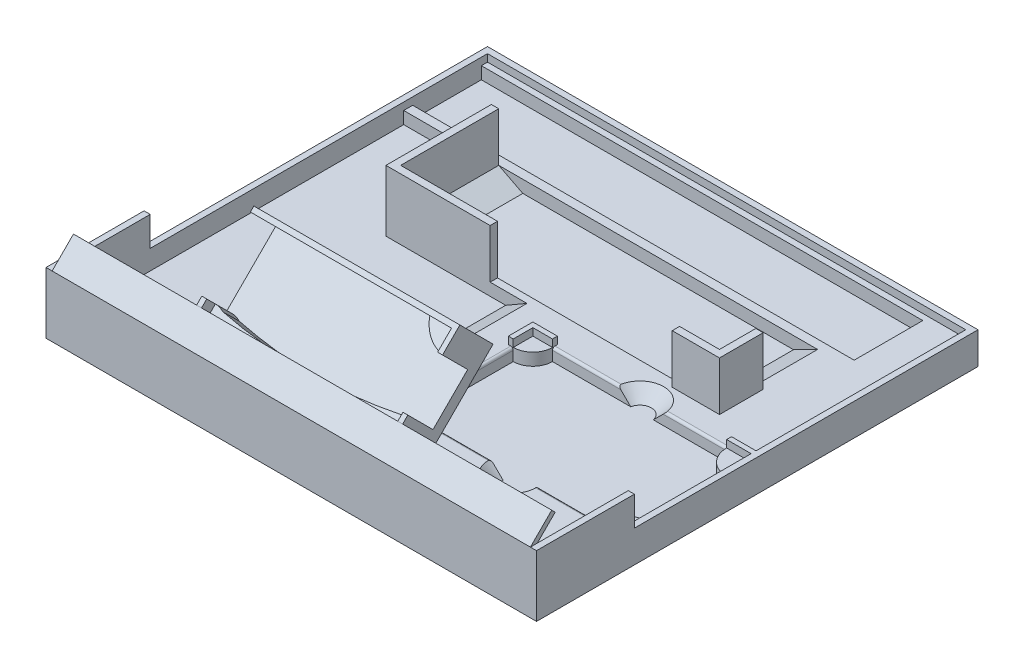
from build123d import *

# Parameters (mm, degrees)
SKETCH1_W            = 200
SKETCH1_H            = 180
BOSS_EXTRUDE1_DEPTH  = 10
SKETCH2_W            = 200
SKETCH2_H            = 180
SKETCH2_W_2          = 195
SKETCH2_H_2          = 175
BOSS_EXTRUDE2_DEPTH  = 3
SKETCH11_W           = 180
SKETCH11_H           = 28
CUT_EXTRUDE4_DEPTH   = 8
BOSS_EXTRUDE6_DEPTH  = 20
SKETCH4_W            = 10
SKETCH4_H            = 2
BOSS_EXTRUDE3_DEPTH  = 3
CUT_EXTRUDE1_DEPTH   = 5
CHAMFER1_SIZE        = 5
FILLET1_R            = 1
SKETCH7_W            = 84
SKETCH7_H            = 10
BOSS_EXTRUDE4_DEPTH  = 15
CHAMFER2_SIZE        = 10
SKETCH8_W            = 84
SKETCH8_H            = 14.142135624
BOSS_EXTRUDE5_DEPTH  = 40
BOSS_EXTRUDE12_DEPTH = 5
CUT_EXTRUDE5_DEPTH   = 9.5
LOFT2_START          = -40.961892057
LOFT2_DEPTH          = 3
LOFT3_START          = 61.722133944
LOFT3_OUTLINE_W      = 3
LOFT3_OUTLINE_H      = 43.678858874
LOFT3_DEPTH          = 4.277866056
LOFT5_START          = -40.961892057
LOFT5_DEPTH          = 3
LOFT6_START          = -21.123339187
LOFT6_DEPTH          = 3
SKETCH32_W           = 110
SKETCH32_H           = 35
CUT_EXTRUDE6_DEPTH   = 5
CHAMFER6_START       = -10.346513917
CHAMFER6_DEPTH       = 82.846513917
CHAMFER6_2_OUTLINE_W = 1.135860263
CHAMFER6_2_OUTLINE_H = 5
CHAMFER6_2_DEPTH     = 55.207581741
CHAMFER6_START_2     = 82.5
CHAMFER6_3_DEPTH     = 5
CHAMFER8_SIZE        = 5
BOSS_EXTRUDE13_DEPTH = 12
CHAMFER5_SIZE        = 2.5
SKETCH25_W           = 195
SKETCH25_H           = 2
BOSS_EXTRUDE14_DEPTH = 12.3
BOSS_EXTRUDE15_DEPTH = 10


with BuildPart() as part:
    # Sketch1 → Boss-Extrude1 (new body)
    with BuildSketch(Plane(origin=(0, 0, 0), x_dir=(1, 0, 0), z_dir=(0, 1, 0))):
        Rectangle(SKETCH1_W, SKETCH1_H)
    extrude(amount=BOSS_EXTRUDE1_DEPTH)

    # Sketch2 → Boss-Extrude2 (add)
    with BuildSketch(Plane(origin=(0, 10, 0), x_dir=(1, 0, 0), z_dir=(0, 1, 0))):
        Rectangle(SKETCH2_W, SKETCH2_H)
        Rectangle(SKETCH2_W_2, SKETCH2_H_2, mode=Mode.SUBTRACT)
    extrude(amount=BOSS_EXTRUDE2_DEPTH)

    # Sketch11 → Cut-Extrude4 (cut)
    with BuildSketch(Plane(origin=(0, 13, 0), x_dir=(1, 0, 0), z_dir=(0, 1, 0))):
        with Locations((-7.5, 71)):
            Rectangle(SKETCH11_W, SKETCH11_H)
    extrude(amount=-CUT_EXTRUDE4_DEPTH, mode=Mode.SUBTRACT)

    # Sketch12 → Boss-Extrude6 (add)
    with BuildSketch(Plane(origin=(0, 10, 0), x_dir=(1, 0, 0), z_dir=(0, 1, 0))):
        Polygon((-58.75108786, 53.346513917), (-58.75108786, 13.346513917), (-19.25919945, 13.346513917), (-19.25919945, 10.346513917), (-61.75108786, 10.346513917), (-61.75108786, 53.346513917), align=None)
        Polygon((71.24891214, 28.173917959), (71.24891214, 13.346513917), (54.976322897, 13.346513917), (54.976322897, 10.346513917), (74.24891214, 10.346513917), (74.24891214, 28.173917959), align=None)
    extrude(amount=BOSS_EXTRUDE6_DEPTH)

    # Sketch4 → Boss-Extrude3 (add)
    with BuildSketch(Plane(origin=(0, 10, 0), x_dir=(1, 0, 0), z_dir=(0, 1, 0))):
        Polygon((8.5, 0), (8.5, -8), (6.5, -8), (6.5, 2), (16.5, 2), (16.5, 0), align=None)
        Polygon((16.5, -52), (16.5, -54), (6.5, -54), (6.5, -44), (8.5, -44), (8.5, -52), align=None)
        with Locations((92.5, 1)):
            Rectangle(SKETCH4_W, SKETCH4_H)
        with Locations((92.5, -53)):
            Rectangle(SKETCH4_W, SKETCH4_H)
    extrude(amount=BOSS_EXTRUDE3_DEPTH)

    # Sketch5 → Cut-Extrude1 (cut)
    with BuildSketch(Plane(origin=(0, 10, 0), x_dir=(1, 0, 0), z_dir=(0, 1, 0))):
        with BuildLine():
            Line((16.5, 0), (48.405541733, 0))
            ThreePointArc((48.405541733, 0), (53, 3.841715626), (57.594458267, 0))
            Line((57.594458267, 0), (87.5, 0))
            ThreePointArc((87.5, 0), (90.428932188, -7.071067812), (97.5, -10))
            Line((97.5, -10), (97.5, -42))
            ThreePointArc((97.5, -42), (90.428932188, -44.928932188), (87.5, -52))
            Line((87.5, -52), (57.594458267, -52))
            ThreePointArc((57.594458267, -52), (53, -57.494692689), (48.405541733, -52))
            Line((48.405541733, -52), (16.5, -52))
            ThreePointArc((16.5, -52), (14.156854249, -46.343145751), (8.5, -44))
            Line((8.5, -44), (8.5, -8))
            ThreePointArc((8.5, -8), (14.156854249, -5.656854249), (16.5, 0))
        make_face()
    extrude(amount=-CUT_EXTRUDE1_DEPTH, mode=Mode.SUBTRACT)

    # Chamfer1
    chamfer1_edges = [part.edges().sort_by_distance(p)[0] for p in [
        (53, 10, -3.841715626),
        (53, 10, 57.494692689),
    ]]
    chamfer(chamfer1_edges, length=CHAMFER1_SIZE - 0.0001)  # a hair under: the kernel refuses the full size

    # Fillet1
    # the kernel refuses this fillet: 1 mm, written as the material it takes off along each edge
    with BuildSketch(Plane(origin=(8.5, 10, 44), x_dir=(-1, 0, 0), z_dir=(0, 0, -1))) as fillet1_piece_1:
        with BuildLine():
            CenterArc((FILLET1_R, -FILLET1_R), FILLET1_R, 90, 90)
            Line((0, -FILLET1_R), (0, 0))
            Line((0, 0), (FILLET1_R, 0))
        make_face()
    extrude(amount=36, mode=Mode.SUBTRACT)
    with BuildSketch(Plane(origin=(45.867287261, 10, 52), x_dir=(0, 0, 1), z_dir=(-1, 0, 0)), Plane(origin=(16.5, 10, 0), x_dir=(0, 0, -1), z_dir=(1, 0, 0))) as fillet1_piece_2:
        with BuildLine():
            CenterArc((FILLET1_R, -FILLET1_R), FILLET1_R, 90, 90)
            Line((0, -FILLET1_R), (0, 0))
            Line((0, 0), (FILLET1_R, 0))
        make_face()
    extrude(amount=29.367287261, mode=Mode.SUBTRACT)
    with BuildSketch(Plane(origin=(87.5, 10, 52), x_dir=(0, 0, 1), z_dir=(-1, 0, 0)), Plane(origin=(60.132712739, 10, 0), x_dir=(0, 0, -1), z_dir=(1, 0, 0))) as fillet1_piece_3:
        with BuildLine():
            CenterArc((FILLET1_R, -FILLET1_R), FILLET1_R, 90, 90)
            Line((0, -FILLET1_R), (0, 0))
            Line((0, 0), (FILLET1_R, 0))
        make_face()
    extrude(amount=27.367287261, mode=Mode.SUBTRACT)

    # Sketch7 → Boss-Extrude4 (add)
    with BuildSketch(Plane(origin=(0, 10, 0), x_dir=(1, 0, 0), z_dir=(0, 1, 0))):
        with Locations((-5.5, -77.5)):
            Rectangle(SKETCH7_W, SKETCH7_H)
    extrude(amount=BOSS_EXTRUDE4_DEPTH)

    # Chamfer2
    chamfer2_edges = [part.edges().sort_by_distance(p)[0] for p in [
        (-5.5, 25, 72.5),
    ]]
    chamfer(chamfer2_edges, length=CHAMFER2_SIZE - 0.0001)  # a hair under: the kernel refuses the full size

    # Sketch8 → Boss-Extrude5 (add)
    with BuildSketch(Plane(origin=(0, -28.75, 28.75), x_dir=(1, 0, 0), z_dir=(0, 0.7071067811865446, -0.7071067811865506))):
        with Locations((-5.5, -68.942911166)):
            Rectangle(SKETCH8_W, SKETCH8_H)
    extrude(amount=BOSS_EXTRUDE5_DEPTH)

    # Sketch22 → Boss-Extrude12 (add)
    with BuildSketch(Plane(origin=(0, 53.75, 53.75), x_dir=(1, 0, 0), z_dir=(0, 0.7071067811865507, 0.7071067811865446))):
        Polygon((-47.5, -0.658639918), (-47.5, -2.658639918), (-45.5, -2.658639918), (34.5, -2.658639918), (34.5, -10.658639918), (36.5, -10.658639918), (36.5, -0.658639918), align=None)
        Polygon((-47.5, -40.658639918), (36.5, -40.658639918), (36.5, -30.658639918), (34.5, -30.658639918), (34.5, -38.658639918), (-45.5, -38.658639918), (-45.5, -30.658639918), (-47.5, -30.658639918), align=None)
    extrude(amount=BOSS_EXTRUDE12_DEPTH)

    # Sketch23 → Cut-Extrude5 (cut)
    with BuildSketch(Plane(origin=(0, 53.75, 53.75), x_dir=(1, 0, 0), z_dir=(0, 0.7071067811865507, 0.7071067811865446))):
        with BuildLine():
            Line((-47.5, -2.658639918), (14.408313461, -2.658639918))
            Line((14.408313461, -2.658639918), (22.14057939, -2.658639918))
            ThreePointArc((22.14057939, -2.658639918), (27.138694447, -8.484119002), (34.5, -10.658639918))
            Line((34.5, -10.658639918), (36.5, -10.658639918))
            Line((36.5, -10.658639918), (36.5, -30.658639918))
            Line((36.5, -30.658639918), (34.5, -30.658639918))
            ThreePointArc((34.5, -30.658639918), (32.65013037, -30.875454044), (30.900530206, -31.514144331))
            ThreePointArc((30.900530206, -31.514144331), (-5.498259382, -34.440048812), (-41.897184507, -31.515830911))
            ThreePointArc((-41.897184507, -31.515830911), (-43.648307809, -30.875887447), (-45.5, -30.658639918))
            Line((-45.5, -30.658639918), (-47.5, -30.658639918))
            Line((-47.5, -30.658639918), (-47.5, -2.658639918))
        make_face()
    extrude(amount=-CUT_EXTRUDE5_DEPTH, mode=Mode.SUBTRACT)

    # Loft2: read off the stored shape, not the designer's step
    # Loft2 outline → Loft2 (add)
    with BuildSketch(Plane.YZ.offset(LOFT2_START)):
        Polygon((10, 72.5), (43.284271247, 44.215728753), (15, 72.5), align=None)
    extrude(amount=LOFT2_DEPTH)

    # Loft3: read off the stored shape, not the designer's step
    # Loft3 outline → Loft3 (add)
    with BuildSketch(Plane(origin=(0, 0, 0), x_dir=(1, 0, 0), z_dir=(0, 0.6475505994673441, 0.7620224544785301)).offset(LOFT3_START)):
        with Locations((-19.623339187, -17.48776448)):
            Rectangle(LOFT3_OUTLINE_W, LOFT3_OUTLINE_H)
    extrude(amount=LOFT3_DEPTH)

    # Loft5: read off the stored shape, not the designer's step
    # Loft5 outline → Loft5 (add)
    with BuildSketch(Plane.YZ.offset(LOFT5_START)):
        Polygon((10, 44.861067824), (43.284271247, 44.215728753), (10, 72.5), align=None)
    extrude(amount=LOFT5_DEPTH)

    # Loft6: read off the stored shape, not the designer's step
    # Loft6 outline → Loft6 (add)
    with BuildSketch(Plane.YZ.offset(LOFT6_START)):
        Polygon((10, 44.861067824), (43.284271247, 44.215728753), (10, 72.5), align=None)
    extrude(amount=LOFT6_DEPTH)

    # Sketch32 → Cut-Extrude6 (cut)
    with BuildSketch(Plane(origin=(0, 10, 0), x_dir=(1, 0, 0), z_dir=(0, 1, 0))):
        Polygon((-97.5, -87.5), (-97.5, 53.346513917), (-61.75108786, 53.346513917), (-61.75108786, 10.346513917), (-19.25919945, 10.346513917), (-19.25919945, -44.861067824), (-21.123339187, -44.861067824), (-21.123339187, -72.5), (-37.961892057, -72.5), (-37.961892057, -44.861067824), (-40.961892057, -44.861067824), (-40.961892057, -72.5), (-47.5, -72.5), (-47.5, -82.5), (-21.123339187, -82.5), (-21.123339187, -87.5), align=None)
        with Locations((6.24891214, 35.846513917)):
            Rectangle(SKETCH32_W, SKETCH32_H)
    extrude(amount=-CUT_EXTRUDE6_DEPTH, mode=Mode.SUBTRACT)

    # Chamfer6: read off the stored shape, not the designer's step
    # Chamfer6 outline → Chamfer6 (cut)
    with BuildSketch(Plane.XY.offset(CHAMFER6_START)):
        Polygon((-18.123339187, 10), (-18.123339187, 5), (-12.919453488, 5), (-4.25919945, 10), align=None)
    extrude(amount=CHAMFER6_DEPTH, mode=Mode.SUBTRACT)

    # Chamfer6 2 outline → Chamfer6 2 (cut)
    with BuildSketch(Plane.XY.offset(CHAMFER6_START)):
        with Locations((-18.691269319, 7.5)):
            Rectangle(CHAMFER6_2_OUTLINE_W, CHAMFER6_2_OUTLINE_H)
    extrude(amount=CHAMFER6_2_DEPTH, mode=Mode.SUBTRACT)

    # Chamfer6 3 outline → Chamfer6 3 (cut)
    with BuildSketch(Plane.XY.offset(CHAMFER6_START_2)):
        Polygon((-14.783593225, 5), (-6.123339187, 10), (-21.123339187, 10), (-21.123339187, 5), align=None)
    extrude(amount=CHAMFER6_3_DEPTH, mode=Mode.SUBTRACT)

    # Chamfer7
    # the kernel refuses this chamfer: 10, 5.095254495 mm, written as the material it takes off along each edge
    with BuildSketch(Plane(origin=(-48.75108786, 10, -18.346513917), x_dir=(-1, 0, 0), z_dir=(0, 0, -1))) as chamfer7_piece_1_section:
        with BuildLine():
            Line((10.35640261, 0.1815962), (-0.35640261, -5.276850695))
            Line((-0.35640261, -5.276850695), (-0.55640261, -5.276850695))
            ThreePointArc((-0.55640261, -5.276850695), (-0.2, -2.638425347), (-0.2, 0))
            Line((-0.2, 0), (0, 0.2))
            ThreePointArc((0, 0.2), (5.178201305, 0.2), (10.35640261, 0.3815962))
            Line((10.35640261, 0.3815962), (10.35640261, 0.1815962))
        make_face()
    chamfer7_piece_1 = extrude(amount=35, mode=Mode.PRIVATE)
    chamfer7_piece_1 = split(chamfer7_piece_1, bisect_by=Plane(origin=(-58.75108786, 10, -18.346513917), z_dir=(1, 0, 0)), keep=Keep.TOP, mode=Mode.PRIVATE)
    chamfer7_piece_1 = split(chamfer7_piece_1, bisect_by=Plane(origin=(-48.75108786, 5, -18.346513917), z_dir=(0, 1, 0)), keep=Keep.TOP, mode=Mode.PRIVATE)
    add(chamfer7_piece_1, mode=Mode.SUBTRACT)
    with BuildSketch(Plane(origin=(61.24891214, 10, -53.346513917), x_dir=(1, 0, 0), z_dir=(0, 0, 1))) as chamfer7_piece_2_section:
        with BuildLine():
            Line((10.35640261, 0.1815962), (-0.35640261, -5.276850695))
            Line((-0.35640261, -5.276850695), (-0.55640261, -5.276850695))
            ThreePointArc((-0.55640261, -5.276850695), (-0.2, -2.638425347), (-0.2, 0))
            Line((-0.2, 0), (0, 0.2))
            ThreePointArc((0, 0.2), (5.178201305, 0.2), (10.35640261, 0.3815962))
            Line((10.35640261, 0.3815962), (10.35640261, 0.1815962))
        make_face()
    chamfer7_piece_2 = extrude(amount=35, mode=Mode.PRIVATE)
    chamfer7_piece_2 = split(chamfer7_piece_2, bisect_by=Plane(origin=(71.24891214, 10, -53.346513917), z_dir=(-1, 0, 0)), keep=Keep.TOP, mode=Mode.PRIVATE)
    chamfer7_piece_2 = split(chamfer7_piece_2, bisect_by=Plane(origin=(61.24891214, 5, -53.346513917), z_dir=(0, 1, 0)), keep=Keep.TOP, mode=Mode.PRIVATE)
    add(chamfer7_piece_2, mode=Mode.SUBTRACT)

    # Chamfer8
    chamfer8_edges = [part.edges().sort_by_distance(p)[0] for p in [
        (6.24891214, 10, -18.346513917),
    ]]
    chamfer(chamfer8_edges, length=CHAMFER8_SIZE - 0.0001)  # a hair under: the kernel refuses the full size

    # Sketch24 → Boss-Extrude13 (add)
    with BuildSketch(Plane(origin=(0, 13, 0), x_dir=(1, 0, 0), z_dir=(0, 1, 0))):
        Polygon((-100, -90), (100, -90), (100, -50.108827803), (97.5, -50.108827803), (97.5, -87.5), (-97.5, -87.5), (-97.5, -50), (-100, -50), align=None)
    extrude(amount=BOSS_EXTRUDE13_DEPTH)

    # Chamfer5
    chamfer5_edges = [part.edges().sort_by_distance(p)[0] for p in [
        (0, 25, 87.5),
    ]]
    chamfer(chamfer5_edges, length=CHAMFER5_SIZE - 0.0001)  # a hair under: the kernel refuses the full size

    # Sketch25 → Boss-Extrude14 (add)
    with BuildSketch(Plane(origin=(0, -32.5, 32.5), x_dir=(1, 0, 0), z_dir=(0, 0.7071067811865408, -0.7071067811865543))):
        with Locations((0, -80.317279836)):
            Rectangle(SKETCH25_W, SKETCH25_H)
    extrude(amount=BOSS_EXTRUDE14_DEPTH)

    # Sketch26 → Boss-Extrude15 (add)
    with BuildSketch(Plane(origin=(0, -23.802586591, 23.802586591), x_dir=(1, 0, 0), z_dir=(0, 0.7071067811865441, -0.707106781186551))):
        Polygon((-97.5, -79.317279836), (-97.5, -81.317279836), (-47.5, -81.317279836), (-45.50354013, -81.317279836), (-41.00354013, -81.317279836), (-41.00354013, -79.317279836), (-45.5, -79.317279836), (-47.5, -79.317279836), align=None)
        Polygon((97.5, -79.317279836), (97.5, -81.317279836), (36.492919741, -81.317279836), (30, -81.317279836), (30, -79.317279836), (34.5, -79.317279836), (36.5, -79.317279836), align=None)
    extrude(amount=-BOSS_EXTRUDE15_DEPTH)


solid = part.part
